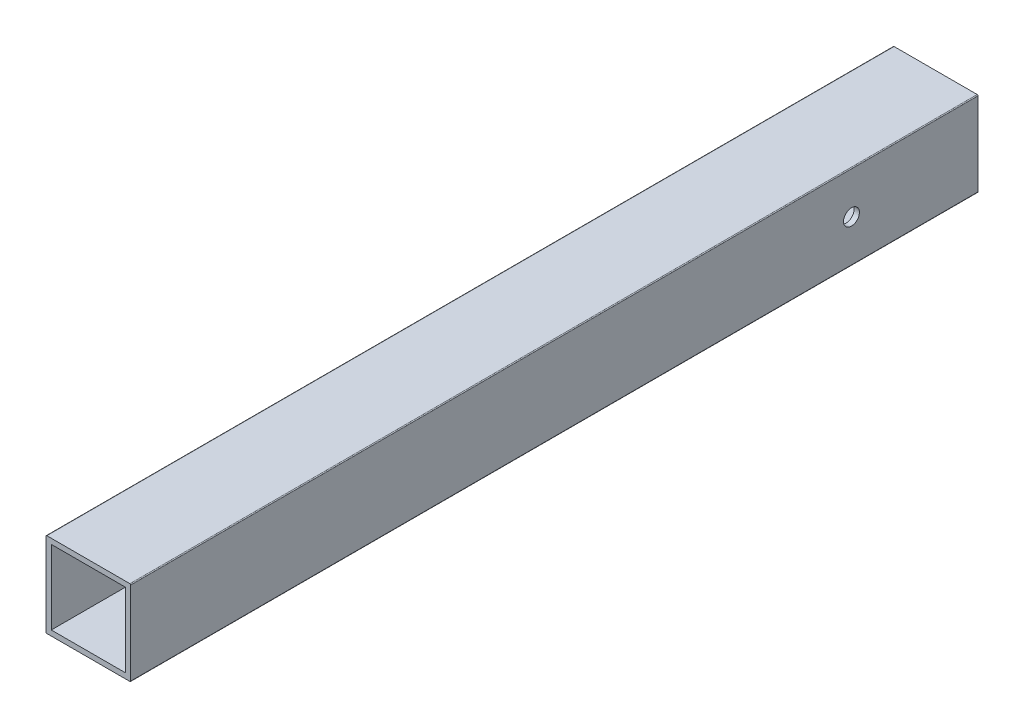
from build123d import *

# Parameters (mm, degrees)
SKETCH1_W           = 22.225
SKETCH1_H           = 22.225
BOSS_EXTRUDE1_DEPTH = 254
SKETCH4_R           = 2.38125
CUT_EXTRUDE2_DEPTH  = 257.375106351


with BuildPart() as part:
    # Sketch1 → Boss-Extrude1 (new body)
    with BuildSketch(Plane(origin=(0, 0, 0), x_dir=(-1, 0, 0), z_dir=(0, 0, -1))):
        with BuildLine():
            Line((1.5875, -1.3335), (1.5875, 23.5585))
            ThreePointArc((1.5875, 23.5585), (1.513105122, 23.738105122), (1.3335, 23.8125))
            Line((1.3335, 23.8125), (-23.5585, 23.8125))
            ThreePointArc((-23.5585, 23.8125), (-23.738105122, 23.738105122), (-23.8125, 23.5585))
            Line((-23.8125, 23.5585), (-23.8125, -1.3335))
            ThreePointArc((-23.8125, -1.3335), (-23.738105122, -1.513105122), (-23.5585, -1.5875))
            Line((-23.5585, -1.5875), (1.3335, -1.5875))
            ThreePointArc((1.3335, -1.5875), (1.513105122, -1.513105122), (1.5875, -1.3335))
        make_face()
        with Locations((-11.1125, 11.1125)):
            Rectangle(SKETCH1_W, SKETCH1_H, mode=Mode.SUBTRACT)
    extrude(amount=-BOSS_EXTRUDE1_DEPTH)

    # Sketch4 → Cut-Extrude2 (cut, through all)
    with BuildSketch(Plane(origin=(23.8125, 0, 0), x_dir=(0, 0, -1), z_dir=(1, 0, 0))):
        with Locations((-37.933268304, 11.1125)):
            Circle(SKETCH4_R)
    extrude(amount=-CUT_EXTRUDE2_DEPTH, mode=Mode.SUBTRACT)


solid = part.part
